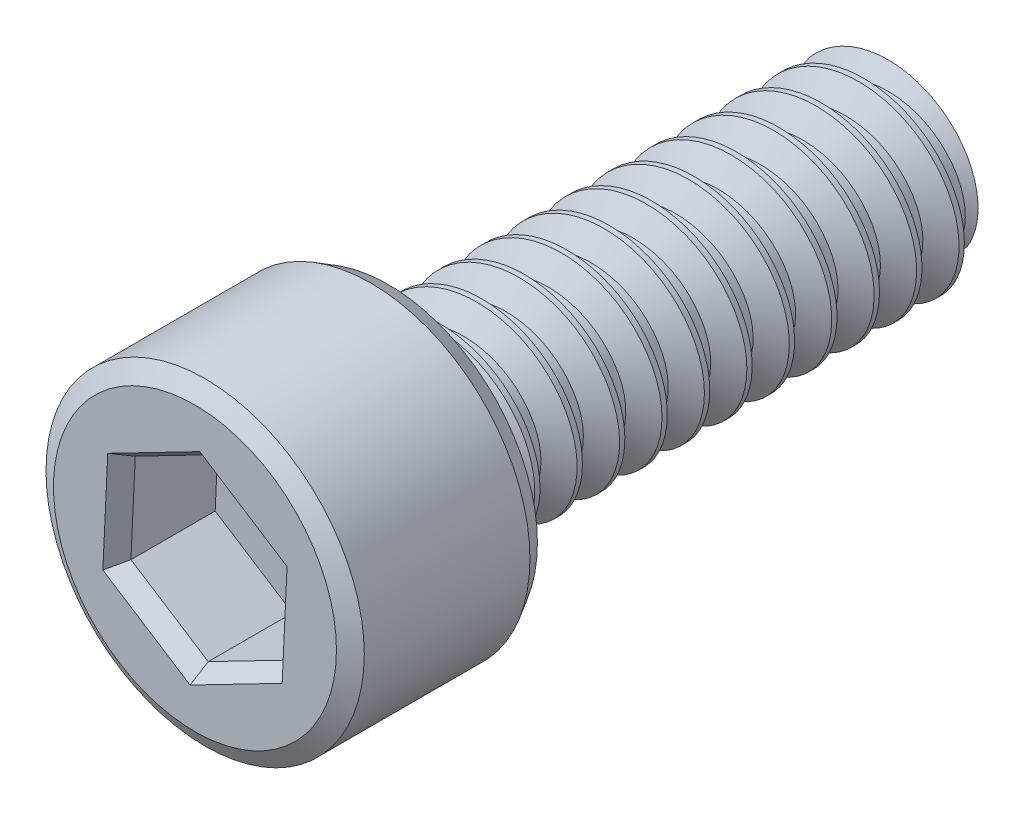
from build123d import *
from OCP.BRepFilletAPI import BRepFilletAPI_MakeChamfer

# Parameters (mm, degrees)
SKETCH1_R           = 3.96875
BOSS_EXTRUDE1_DEPTH = 4.826
CUT_EXTRUDE1_DEPTH  = 2.54
SKETCH3_R           = 2.413
BOSS_EXTRUDE2_DEPTH = 12.7
CHAMFER2_SIZE       = 0.254
CHAMFER2_SIZE2      = 0.439940905
THREAD1_PITCH       = 1.058333333


with BuildPart() as part:
    # Sketch1 → Boss-Extrude1 (new body)
    with BuildSketch(Plane.XY):
        Circle(SKETCH1_R)
    extrude(amount=BOSS_EXTRUDE1_DEPTH)

    # Sketch2 → Cut-Extrude1 (cut)
    with BuildSketch(Plane.XY.offset(4.826)):
        Polygon((1.928249756, -1.23781194), (2.036101463, 1.051007303), (0.107851707, 2.288819244), (-1.928249756, 1.23781194), (-2.036101463, -1.051007303), (-0.107851707, -2.288819244), align=None)
    extrude(amount=-CUT_EXTRUDE1_DEPTH, mode=Mode.SUBTRACT)

    # Sketch3 → Boss-Extrude2 (add)
    with BuildSketch(Plane(origin=(0, 0, 0), x_dir=(-1, 0, 0), z_dir=(0, 0, -1))):
        with Locations(Location((0, 0, 0), (0, 0, 180))):
            Circle(SKETCH3_R)
    extrude(amount=BOSS_EXTRUDE2_DEPTH)

    # Chamfer2: one chamfer whose edges measure the first distance from different faces: ONE call of the kernel's chamfer builder (chamfer() names one face for all edges)
    chamfer2_edges_1 = [part.edges().sort_by_distance(p)[0] for p in [
        (0.910199024, -1.763315592, 4.826),
        (1.98217561, -0.093402318, 4.826),
        (1.071976585, 1.669913274, 4.826),
        (-0.910199024, 1.763315592, 4.826),
        (-1.98217561, 0.093402318, 4.826),
        (-1.071976585, -1.669913274, 4.826),
    ]]
    chamfer2_side_1 = [part.faces().sort_by_distance(p)[0] for p in [
        (-3.856496798, 0, 4.826),
    ]]
    chamfer2_edges_2 = [part.edges().sort_by_distance(p)[0] for p in [
        (-3.96875, 0, 0),
    ]]
    chamfer2_side_2 = [part.faces().sort_by_distance(p)[0] for p in [
        (-3.856496798, 0, 0),
    ]]
    chamfer2_edges_3 = [part.edges().sort_by_distance(p)[0] for p in [
        (-2.413, 0, -12.7),
    ]]
    chamfer2_side_3 = [part.faces().sort_by_distance(p)[0] for p in [
        (-2.413, 0, -6.35),
    ]]
    chamfer2_edges_4 = [part.edges().sort_by_distance(p)[0] for p in [
        (-3.96875, 0, 4.826),
    ]]
    chamfer2_side_4 = [part.faces().sort_by_distance(p)[0] for p in [
        (-3.96875, 0, 2.413),
    ]]
    chamfer2 = BRepFilletAPI_MakeChamfer(part.part.solid().wrapped)
    for e in chamfer2_edges_1:
        chamfer2.Add(CHAMFER2_SIZE, CHAMFER2_SIZE2, e.wrapped, chamfer2_side_1[0].wrapped)  # the first distance lies on this face
    for e in chamfer2_edges_2:
        chamfer2.Add(CHAMFER2_SIZE, CHAMFER2_SIZE2, e.wrapped, chamfer2_side_2[0].wrapped)  # the first distance lies on this face
    for e in chamfer2_edges_3:
        chamfer2.Add(CHAMFER2_SIZE, CHAMFER2_SIZE2, e.wrapped, chamfer2_side_3[0].wrapped)  # the first distance lies on this face
    for e in chamfer2_edges_4:
        chamfer2.Add(CHAMFER2_SIZE, CHAMFER2_SIZE2, e.wrapped, chamfer2_side_4[0].wrapped)  # the first distance lies on this face
    add(Compound.cast(chamfer2.Shape()), mode=Mode.REPLACE)

    # Thread1: arcs per turn and ends read off the stored shape
    # Thread1: the profile of Thread Profile1 profile screwed along a right-hand helix through 14.400003 turns, 8 arcs to a turn; built about Z, then put on its axis
    thread1_z = Axis((0, 0, 0), (0, 0, 1))
    thread1_corners = [(2.4133, 0, -0.000173205), (2.4133, 0, 0.926214869), (1.840160282, 0, 0.595312499), (1.840160282, 0, 0.330729165)]
    with BuildLine(mode=Mode.PRIVATE) as thread1_profile:
        Line(thread1_corners[0], thread1_corners[1])
        Line(thread1_corners[1], thread1_corners[2])
        Line(thread1_corners[2], thread1_corners[3])
        Line(thread1_corners[3], thread1_corners[0])
    thread1_cap = Face(thread1_profile.wire())
    thread1_turn_angles = [0, 22.5, 45, 67.5, 90, 112.5, 135, 157.5, 180, 202.5, 225, 247.5, 270, 292.5, 315, 337.5, 360]
    thread1_turn_weights = [1, 0.9238795325112867, 1, 0.9238795325112867, 1, 0.9238795325112867, 1, 0.9238795325112867, 1, 0.9238795325112867, 1, 0.9238795325112867, 1, 0.9238795325112867, 1, 0.9238795325112867, 1]
    thread1_turn_rails = [Edge.make_bspline([Vector(p[0], p[1], 0).rotate(thread1_z, thread1_turn_angles[k]) / thread1_turn_weights[k] + Vector(0, 0, p[2] + THREAD1_PITCH * thread1_turn_angles[k] / 360) for k in range(17)], [0, 0, 0, 1, 1, 2, 2, 3, 3, 4, 4, 5, 5, 6, 6, 7, 7, 8, 8, 8], 2, thread1_turn_weights) for p in thread1_corners]
    thread1_turn_sides = [Face.make_surface_from_curves(thread1_turn_rails[p[0]], thread1_turn_rails[p[1]]) for p in [(0, 1), (1, 2), (2, 3), (3, 0)]]
    thread1_last_angles = [5040, 5062.5, 5085, 5107.5, 5130, 5152.5, 5175, 5179.5005, 5184.001]
    thread1_last_weights = [1, 0.9238795325112867, 1, 0.9238795325112867, 1, 0.9238795325112867, 1, 0.9969166490103938, 1]
    thread1_last_rails = [Edge.make_bspline([Vector(p[0], p[1], 0).rotate(thread1_z, thread1_last_angles[k]) / thread1_last_weights[k] + Vector(0, 0, p[2] + THREAD1_PITCH * thread1_last_angles[k] / 360) for k in range(9)], [0, 0, 0, 1, 1, 2, 2, 3, 3, 4, 4, 4], 2, thread1_last_weights) for p in thread1_corners]
    thread1_last_sides = [Face.make_surface_from_curves(thread1_last_rails[p[0]], thread1_last_rails[p[1]]) for p in [(0, 1), (1, 2), (2, 3), (3, 0)]]
    thread1 = Plane(origin=(0, 0, -14.986), x_dir=(1, 0, 0), z_dir=(0, 0, 1)) * Solid(Shell([*[p.moved(Location((0, 0, THREAD1_PITCH * i))) for i in range(14) for p in thread1_turn_sides], *thread1_last_sides, thread1_cap, thread1_cap.rotate(thread1_z, 5184.001).moved(Location((0, 0, THREAD1_PITCH * 5184.001 / 360)))]))
    add(thread1, mode=Mode.SUBTRACT)


solid = part.part
